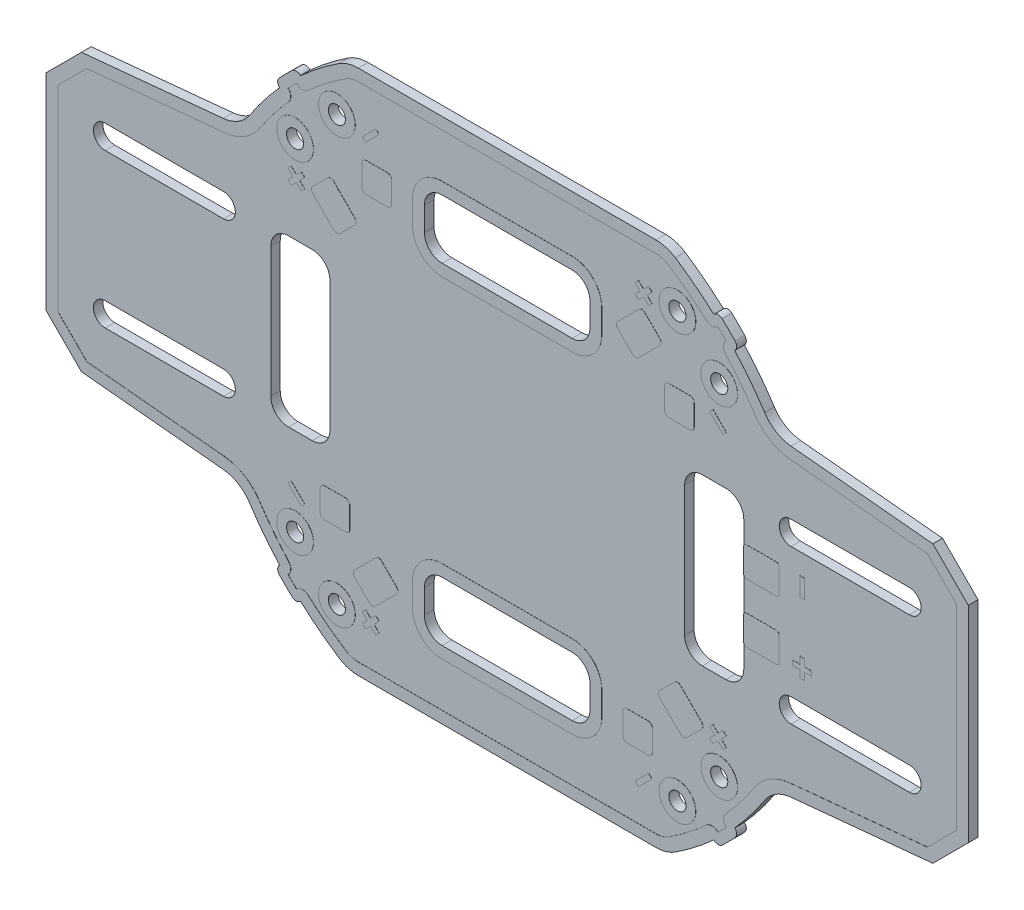
from build123d import *

# Parameters (mm, degrees)
ESQUISSE1_R                     = 1.6
EXTRUSION2_DEPTH                = 0.8
EXTRUSION3_DEPTH                = 90.815421838
EXTRUSION4_START                = 0.02
ESQUISSE5_R                     = 3.1
ESQUISSE5_R_2                   = 1.6
EXTRUSION4_DEPTH                = 0.02
EXTRUSION5_DEPTH                = 0.02
R_P_TITION_CIRCULAIRE1_COUNT    = 4
ESQUISSE7_W                     = 0.8
ESQUISSE7_H                     = 3.2
EXTRUSION6_DEPTH                = 0.02
SUPPRIMERFACE3_START            = -0.82
SUPPRIMERFACE3_OUTLINE_R        = 1.6
SUPPRIMERFACE3_DEPTH            = 1.64
SUPPRIMERFACE4_START            = -0.82
SUPPRIMERFACE4_OUTLINE_R        = 1.6
SUPPRIMERFACE4_DEPTH            = 1.64
SUPPRIMERFACE5_START            = -0.82
SUPPRIMERFACE5_OUTLINE_R        = 1.6
SUPPRIMERFACE5_DEPTH            = 1.64
SUPPRIMERFACE6_START            = -0.82
SUPPRIMERFACE6_OUTLINE_R        = 1.6
SUPPRIMERFACE6_DEPTH            = 1.64
D_GAGEMENT_M2_51_D              = 2.9
R_P_TITION_LIN_AIRE1_COUNT      = 2
R_P_TITION_LIN_AIRE1_PITCH      = 10
R_P_TITION_CIRCULAIRE2_COUNT    = 4
R_P_TITION_CIRCULAIRE2_COPY_1_D = 2.9
R_P_TITION_CIRCULAIRE2_COPY_2_D = 2.9
R_P_TITION_CIRCULAIRE2_COPY_3_D = 2.9


# Read off the part's stored shape, not the designer's step: SupprimerFace3, SupprimerFace4, SupprimerFace5, SupprimerFace6
with BuildPart() as part:
    # Esquisse1 → Extrusion2 (new, symmetric)
    with BuildSketch(Plane.XY):
        with BuildLine():
            Line((78, 17.4), (78, 0))
            Line((78, 0), (0, 0))
            Line((0, 0), (0, 44.5))
            Line((0, 44.5), (25.17439175, 44.5))
            ThreePointArc((25.17439175, 44.5), (26.887512473, 44.25023629), (28.458008066, 43.52173913))
            ThreePointArc((28.458008066, 43.52173913), (31.808099787, 41.136902994), (34.959266687, 38.494800593))
            Line((34.959266687, 38.494800593), (34.986484502, 38.522018408))
            ThreePointArc((34.986484502, 38.522018408), (35.679166705, 38.814807587), (36.3800065, 38.542121466))
            ThreePointArc((36.3800065, 38.542121466), (37.476659403, 37.476659403), (38.542121466, 36.3800065))
            ThreePointArc((38.542121466, 36.3800065), (38.814807587, 35.679166705), (38.522018408, 34.986484502))
            Line((38.522018408, 34.986484502), (38.494800593, 34.959266687))
            ThreePointArc((38.494800593, 34.959266687), (41.155152457, 31.784484049), (43.554377361, 28.408030778))
            ThreePointArc((43.554377361, 28.408030778), (45.472031497, 26.553506518), (48.004060941, 25.713575266))
            Line((48.004060941, 25.713575266), (72, 23.4))
            Line((72, 23.4), (78, 17.4))
        make_face()
        with Locations((28.798658523, 35.869726334)):
            Circle(ESQUISSE1_R, mode=Mode.SUBTRACT)
        with Locations(Location((35.869726334, 28.798658523, 0), (0, 0, 180))):
            Circle(ESQUISSE1_R, mode=Mode.SUBTRACT)
        with BuildLine():
            Line((68, 15), (48, 15))
            ThreePointArc((48, 15), (46, 13), (48, 11))
            Line((48, 11), (68, 11))
            ThreePointArc((68, 11), (70, 13), (68, 15))
        make_face(mode=Mode.SUBTRACT)
    extrude(amount=EXTRUSION2_DEPTH, both=True)

    # Esquisse3 → Extrusion3 (cut, through all)
    with BuildSketch(Plane.XY.offset(0.8)):
        with BuildLine():
            Line((-11, 33), (11, 33))
            ThreePointArc((11, 33), (13.121320344, 32.121320344), (14, 30))
            Line((14, 30), (14, 26))
            ThreePointArc((14, 26), (13.121320344, 23.878679656), (11, 23))
            Line((11, 23), (-11, 23))
            ThreePointArc((-11, 23), (-13.121320344, 23.878679656), (-14, 26))
            Line((-14, 26), (-14, 30))
            ThreePointArc((-14, 30), (-13.121320344, 32.121320344), (-11, 33))
        make_face()
        with BuildLine():
            Line((33, 14), (37, 14))
            ThreePointArc((37, 14), (39.121320344, 13.121320344), (40, 11))
            Line((40, 11), (40, -11))
            ThreePointArc((40, -11), (39.121320344, -13.121320344), (37, -14))
            Line((37, -14), (33, -14))
            ThreePointArc((33, -14), (30.878679656, -13.121320344), (30, -11))
            Line((30, -11), (30, 11))
            ThreePointArc((30, 11), (30.878679656, 13.121320344), (33, 14))
        make_face()
    extrude(amount=-EXTRUSION3_DEPTH, mode=Mode.SUBTRACT)

    # Esquisse5 → Extrusion4 (add)
    # profile 1 of 4: a face of its own
    with BuildSketch(Plane.XY.offset(0.8).offset(EXTRUSION4_START)):
        with Locations(Location((28.798658523, 35.869726334, 0), (0, 0, 180))):
            Circle(ESQUISSE5_R)
        with Locations((28.798658523, 35.869726334)):
            Circle(ESQUISSE5_R_2, mode=Mode.SUBTRACT)
    # profile 2 of 4: a face of its own
    with BuildSketch(Plane.XY.offset(0.8).offset(EXTRUSION4_START)):
        with Locations(Location((35.869726334, 28.798658523, 0), (0, 0, 180))):
            Circle(ESQUISSE5_R)
        with Locations(Location((35.869726334, 28.798658523, 0), (0, 0, 180))):
            Circle(ESQUISSE5_R_2, mode=Mode.SUBTRACT)
    # profile 3 of 4: a face of its own
    with BuildSketch(Plane.XY.offset(0.8).offset(EXTRUSION4_START)):
        with BuildLine():
            Line((0, 35), (0, 33))
            Line((0, 33), (11, 33))
            ThreePointArc((11, 33), (13.121320344, 32.121320344), (14, 30))
            Line((14, 30), (14, 26))
            ThreePointArc((14, 26), (13.121320344, 23.878679656), (11, 23))
            Line((11, 23), (0, 23))
            Line((0, 23), (0, 21))
            Line((0, 21), (11, 21))
            ThreePointArc((11, 21), (14.535533906, 22.464466094), (16, 26))
            Line((16, 26), (16, 30))
            ThreePointArc((16, 30), (14.535533906, 33.535533906), (11, 35))
            Line((11, 35), (0, 35))
        make_face()
    # profile 4 of 4: a face of its own
    with BuildSketch(Plane.XY.offset(0.8).offset(EXTRUSION4_START)):
        with BuildLine():
            Line((25.17439175, 44.5), (0, 44.5))
            Line((0, 44.5), (0, 42.5))
            Line((0, 42.5), (25.17439175, 42.5))
            ThreePointArc((25.17439175, 42.5), (26.316472232, 42.33349086), (27.363469294, 41.847826087))
            ThreePointArc((27.363469294, 41.847826087), (30.612430511, 39.533265717), (33.666538236, 36.967069172))
            ThreePointArc((33.666538236, 36.967069172), (34.65549529, 36.602912723), (35.618219576, 37.031640988))
            Line((35.618219576, 37.031640988), (35.638181772, 37.052395334))
            Line((35.638181772, 37.052395334), (37.052395334, 35.638181772))
            Line((37.052395334, 35.638181772), (37.031640988, 35.618219576))
            ThreePointArc((37.031640988, 35.618219576), (36.602912723, 34.65549529), (36.967069172, 33.666538236))
            ThreePointArc((36.967069172, 33.666538236), (39.550829189, 30.589735377), (41.879209001, 27.315414209))
            ThreePointArc((41.879209001, 27.315414209), (44.436081183, 24.842715197), (47.812120441, 23.722806861))
            Line((47.812120441, 23.722806861), (71.09344115, 21.478131725))
            Line((71.09344115, 21.478131725), (76, 16.571572875))
            Line((76, 16.571572875), (76, 0))
            Line((76, 0), (78, 0))
            Line((78, 0), (78, 17.4))
            Line((78, 17.4), (72, 23.4))
            Line((72, 23.4), (48.004060941, 25.713575266))
            ThreePointArc((48.004060941, 25.713575266), (45.472031497, 26.553506518), (43.554377361, 28.408030778))
            ThreePointArc((43.554377361, 28.408030778), (41.155152457, 31.784484049), (38.494800593, 34.959266687))
            Line((38.494800593, 34.959266687), (38.522018408, 34.986484502))
            ThreePointArc((38.522018408, 34.986484502), (38.814807587, 35.679166705), (38.542121466, 36.3800065))
            ThreePointArc((38.542121466, 36.3800065), (37.476659403, 37.476659403), (36.3800065, 38.542121466))
            ThreePointArc((36.3800065, 38.542121466), (35.679166705, 38.814807587), (34.986484502, 38.522018408))
            Line((34.986484502, 38.522018408), (34.959266687, 38.494800593))
            ThreePointArc((34.959266687, 38.494800593), (31.808099787, 41.136902994), (28.458008066, 43.52173913))
            ThreePointArc((28.458008066, 43.52173913), (26.887512473, 44.25023629), (25.17439175, 44.5))
        make_face()
    extrusion4 = extrude(amount=-EXTRUSION4_DEPTH)

    # Symétrie3: Extrusion4 across plane
    add(extrusion4.mirror(Plane.XY))

    # Symétrie1: part across plane


with BuildPart() as part_1:
    add(part.part)
    add(part.part.mirror(Plane.ZX))

    # Symétrie2: part across plane


with BuildPart() as part_2:
    add(part_1.part)
    add(part_1.part.mirror(Plane(origin=(0, 0, 0), x_dir=(0, 0, 1), z_dir=(1, 0, 0))))

    # Esquisse6 → Extrusion5 (add)
    with BuildSketch(Plane.XY.offset(0.8)):
        with BuildLine():
            Line((27.327085647, 24.556017835), (30.927085647, 24.556017835))
            ThreePointArc((30.927085647, 24.556017835), (31.422060394, 24.350992582), (31.627085647, 23.856017835))
            Line((31.627085647, 23.856017835), (31.627085647, 20.256017835))
            ThreePointArc((31.627085647, 20.256017835), (31.422060394, 19.761043089), (30.927085647, 19.556017835))
            Line((30.927085647, 19.556017835), (27.327085647, 19.556017835))
            ThreePointArc((27.327085647, 19.556017835), (26.8321109, 19.761043089), (26.627085647, 20.256017835))
            Line((26.627085647, 20.256017835), (26.627085647, 23.856017835))
            ThreePointArc((26.627085647, 23.856017835), (26.8321109, 24.350992582), (27.327085647, 24.556017835))
        make_face()
        with BuildLine():
            Line((23.283225629, 32.899877853), (25.828810042, 30.354293441))
            ThreePointArc((25.828810042, 30.354293441), (26.033835295, 29.859318694), (25.828810042, 29.364343947))
            Line((25.828810042, 29.364343947), (22.222565457, 25.758099363))
            ThreePointArc((22.222565457, 25.758099363), (21.727590711, 25.55307411), (21.232615964, 25.758099363))
            Line((21.232615964, 25.758099363), (18.687031552, 28.303683776))
            ThreePointArc((18.687031552, 28.303683776), (18.482006298, 28.798658523), (18.687031552, 29.293633269))
            Line((18.687031552, 29.293633269), (22.293276136, 32.899877853))
            ThreePointArc((22.293276136, 32.899877853), (22.788250882, 33.104903107), (23.283225629, 32.899877853))
        make_face()
        Polygon((22.222565457, 37.071807862), (23.071093595, 36.223279725), (23.919621732, 37.071807862), (24.485307157, 36.506122437), (23.63677902, 35.6575943), (24.485307157, 34.809066163), (23.919621732, 34.243380738), (23.071093595, 35.091908875), (22.222565457, 34.243380738), (21.656880033, 34.809066163), (22.50540817, 35.6575943), (21.656880033, 36.506122437), align=None)
        Polygon((36.506122437, 21.656880033), (37.071807862, 22.222565457), (34.809066163, 24.485307157), (34.243380738, 23.919621732), align=None)
    extrusion5 = extrude(amount=EXTRUSION5_DEPTH)

    # Répétition circulaire1: Extrusion5 ×4 about axis
    r_p_tition_circulaire1_axis = Axis((0, 0, 0), (0, 0, 1))
    for i in range(1, R_P_TITION_CIRCULAIRE1_COUNT):
        add(extrusion5.rotate(r_p_tition_circulaire1_axis, i * 360 / R_P_TITION_CIRCULAIRE1_COUNT))

    # Esquisse7 → Extrusion6 (add)
    with BuildSketch(Plane.XY.offset(0.8)):
        with BuildLine():
            Line((40.5, 7.5), (45.5, 7.5))
            ThreePointArc((45.5, 7.5), (45.853553391, 7.353553391), (46, 7))
            Line((46, 7), (46, 3))
            ThreePointArc((46, 3), (45.853553391, 2.646446609), (45.5, 2.5))
            Line((45.5, 2.5), (40.5, 2.5))
            ThreePointArc((40.5, 2.5), (40.146446609, 2.646446609), (40, 3))
            Line((40, 3), (40, 7))
            ThreePointArc((40, 7), (40.146446609, 7.353553391), (40.5, 7.5))
        make_face()
        with BuildLine():
            Line((46, -7), (46, -3))
            ThreePointArc((46, -3), (45.853553391, -2.646446609), (45.5, -2.5))
            Line((45.5, -2.5), (40.5, -2.5))
            ThreePointArc((40.5, -2.5), (40.146446609, -2.646446609), (40, -3))
            Line((40, -3), (40, -7))
            ThreePointArc((40, -7), (40.146446609, -7.353553391), (40.5, -7.5))
            Line((40.5, -7.5), (45.5, -7.5))
            ThreePointArc((45.5, -7.5), (45.853553391, -7.353553391), (46, -7))
        make_face()
        with Locations((49.9, 5.9)):
            Rectangle(ESQUISSE7_W, ESQUISSE7_H)
        Polygon((49.5, -4.3), (50.3, -4.3), (50.3, -5.5), (51.5, -5.5), (51.5, -6.3), (50.3, -6.3), (50.3, -7.5), (49.5, -7.5), (49.5, -6.3), (48.3, -6.3), (48.3, -5.5), (49.5, -5.5), align=None)
    extrude(amount=EXTRUSION6_DEPTH)

    # SupprimerFace3 outline → SupprimerFace3 (add)
    with BuildSketch(Plane.XY.offset(SUPPRIMERFACE3_START)):
        with Locations((-28.798658523, -35.869726334)):
            Circle(SUPPRIMERFACE3_OUTLINE_R)
        with Locations((-35.869726334, -28.798658523)):
            Circle(SUPPRIMERFACE3_OUTLINE_R)
    extrude(amount=SUPPRIMERFACE3_DEPTH)

    # SupprimerFace4 outline → SupprimerFace4 (add)
    with BuildSketch(Plane.XY.offset(SUPPRIMERFACE4_START)):
        with Locations((-28.798658523, 35.869726334)):
            Circle(SUPPRIMERFACE4_OUTLINE_R)
        with Locations((-35.869726334, 28.798658523)):
            Circle(SUPPRIMERFACE4_OUTLINE_R)
    extrude(amount=SUPPRIMERFACE4_DEPTH)

    # SupprimerFace5 outline → SupprimerFace5 (add)
    with BuildSketch(Plane.XY.offset(SUPPRIMERFACE5_START)):
        with Locations((28.798658523, 35.869726334)):
            Circle(SUPPRIMERFACE5_OUTLINE_R)
        with Locations((35.869726334, 28.798658523)):
            Circle(SUPPRIMERFACE5_OUTLINE_R)
    extrude(amount=SUPPRIMERFACE5_DEPTH)

    # SupprimerFace6 outline → SupprimerFace6 (add)
    with BuildSketch(Plane.XY.offset(SUPPRIMERFACE6_START)):
        with Locations((28.798658523, -35.869726334)):
            Circle(SUPPRIMERFACE6_OUTLINE_R)
        with Locations((35.869726334, -28.798658523)):
            Circle(SUPPRIMERFACE6_OUTLINE_R)
    extrude(amount=SUPPRIMERFACE6_DEPTH)

    # Dégagement M2.51 (through all)
    with Locations(Plane.XY.offset(0.82)):
        with Locations((-35.869726334, -28.798658523)):
            d_gagement_m2_51 = Hole(D_GAGEMENT_M2_51_D / 2)

    # Répétition linéaire1: Dégagement M2.51 ×2
    with Locations(*[Vector(0.7071067811865489, -0.7071067811865461, 0) * (i * R_P_TITION_LIN_AIRE1_PITCH) for i in range(1, R_P_TITION_LIN_AIRE1_COUNT)]):
        add(d_gagement_m2_51, mode=Mode.SUBTRACT)

    # Répétition circulaire2: Dégagement M2.51 ×4 about axis
    r_p_tition_circulaire2_axis = Axis((0, 0, 0), (0, 0, 1))
    for i in range(1, R_P_TITION_CIRCULAIRE2_COUNT):
        add(d_gagement_m2_51.rotate(r_p_tition_circulaire2_axis, i * 360 / R_P_TITION_CIRCULAIRE2_COUNT), mode=Mode.SUBTRACT)

    # Répétition circulaire2 copy 1 (through all)
    with Locations(Plane(origin=(7.071067812, 7.071067812, 0.82), x_dir=(0, 1, 0), z_dir=(0, 0, 1))):
        with Locations((-35.869726334, -28.798658523)):
            Hole(R_P_TITION_CIRCULAIRE2_COPY_1_D / 2)

    # Répétition circulaire2 copy 2 (through all)
    with Locations(Plane(origin=(-7.071067812, 7.071067812, 0.82), x_dir=(-1, 0, 0), z_dir=(0, 0, 1))):
        with Locations((-35.869726334, -28.798658523)):
            Hole(R_P_TITION_CIRCULAIRE2_COPY_2_D / 2)

    # Répétition circulaire2 copy 3 (through all)
    with Locations(Plane(origin=(-7.071067812, -7.071067812, 0.82), x_dir=(0, -1, 0), z_dir=(0, 0, 1))):
        with Locations((-35.869726334, -28.798658523)):
            Hole(R_P_TITION_CIRCULAIRE2_COPY_3_D / 2)


solid = part_2.part
